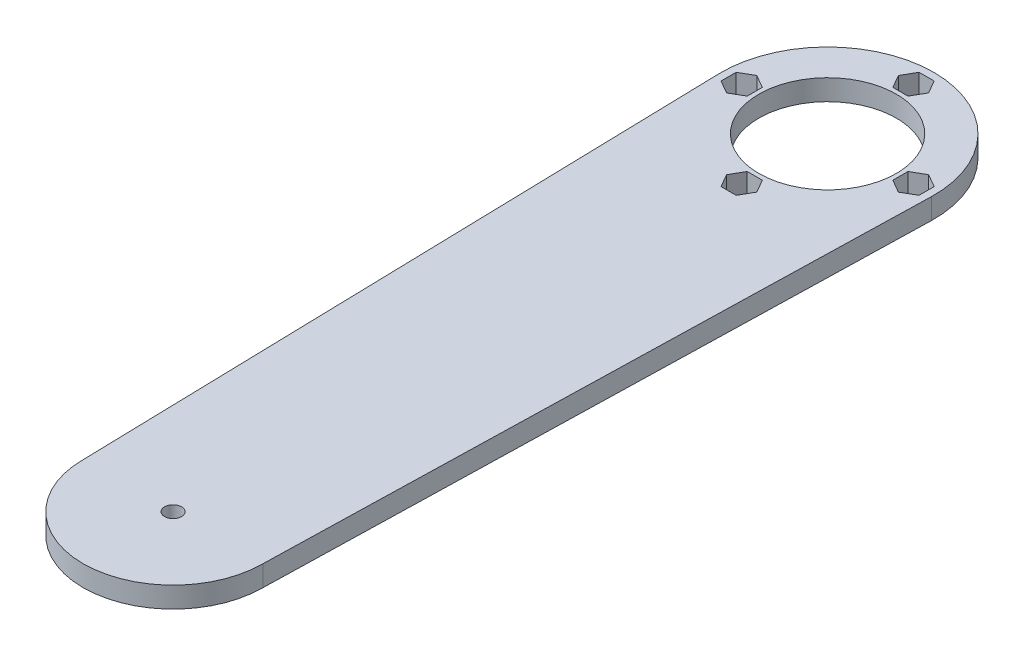
from build123d import *

# Parameters (mm, degrees)
BOSS_EXTRUDE1_DEPTH          = 6.35
SKETCH2_R                    = 2.6
CUT_EXTRUDE1_DEPTH           = 235.846380641
ESQUISSE3_R                  = 21
ENL_V_MAT_EXTRU_2_DEPTH      = 235.846380641
ESQUISSE7_R                  = 4
ENL_V_MAT_EXTRU_3_DEPTH      = 235.846380641
ENL_V_MAT_EXTRU_5_DEPTH      = 235.846380641
R_P_TITION_CIRCULAIRE1_COUNT = 4


with BuildPart() as part:
    # Sketch1 → Boss-Extrude1 (new body)
    with BuildSketch(Plane(origin=(0, 0, 0), x_dir=(1, 0, 0), z_dir=(0, 1, 0))):
        with BuildLine():
            ThreePointArc((-27.5, 0), (0, -27.5), (27.5, 0))
            Line((27.5, 0), (32.489807083, 199.186098474))
            ThreePointArc((32.489807083, 199.186098474), (0, 232.5), (-32.489807083, 199.186098474))
            Line((-32.489807083, 199.186098474), (-27.5, 0))
        make_face()
    extrude(amount=BOSS_EXTRUDE1_DEPTH)

    # Sketch2 → Cut-Extrude1 (cut, through all)
    with BuildSketch(Plane(origin=(0, 6.35, 0), x_dir=(1, 0, 0), z_dir=(0, 1, 0))):
        Circle(SKETCH2_R)
    extrude(amount=-CUT_EXTRUDE1_DEPTH, mode=Mode.SUBTRACT)

    # Esquisse3 → Enlèv. mat.-Extru.2 (cut, through all)
    with BuildSketch(Plane(origin=(0, 6.35, 0), x_dir=(1, 0, 0), z_dir=(0, 1, 0))):
        with Locations((0, 200)):
            Circle(ESQUISSE3_R)
    extrude(amount=-ENL_V_MAT_EXTRU_2_DEPTH, mode=Mode.SUBTRACT)

    # Esquisse7 → Enlèv. mat.-Extru.3 (cut, through all)
    with BuildSketch(Plane(origin=(0, 6.35, 0), x_dir=(1, 0, 0), z_dir=(0, 1, 0))):
        with Locations((0, 226.25)):
            Circle(ESQUISSE7_R)
        with Locations((26.25, 200)):
            Circle(ESQUISSE7_R)
        with Locations((0, 173.75)):
            Circle(ESQUISSE7_R)
        with Locations((-26.25, 200)):
            Circle(ESQUISSE7_R)
    extrude(amount=-ENL_V_MAT_EXTRU_3_DEPTH, mode=Mode.SUBTRACT)

    # Esquisse8 → Enlèv. mat.-Extru.5 (cut, through all)
    with BuildSketch(Plane(origin=(0, 6.35, 0), x_dir=(1, 0, 0), z_dir=(0, 1, 0))):
        Polygon((-2.309401077, 177.75), (2.309401077, 177.75), (4.618802154, 173.75), (2.309401077, 169.75), (-2.309401077, 169.75), (-4.618802154, 173.75), align=None)
    enl_v_mat_extru_5 = extrude(amount=-ENL_V_MAT_EXTRU_5_DEPTH, mode=Mode.SUBTRACT)

    # Répétition circulaire1: Enlèv. mat.-Extru.5 ×4 about axis
    r_p_tition_circulaire1_axis = Axis((0, 30.779047955, -200), (0, -1, 0))
    for i in range(1, R_P_TITION_CIRCULAIRE1_COUNT):
        add(enl_v_mat_extru_5.rotate(r_p_tition_circulaire1_axis, i * 360 / R_P_TITION_CIRCULAIRE1_COUNT), mode=Mode.SUBTRACT)


solid = part.part
